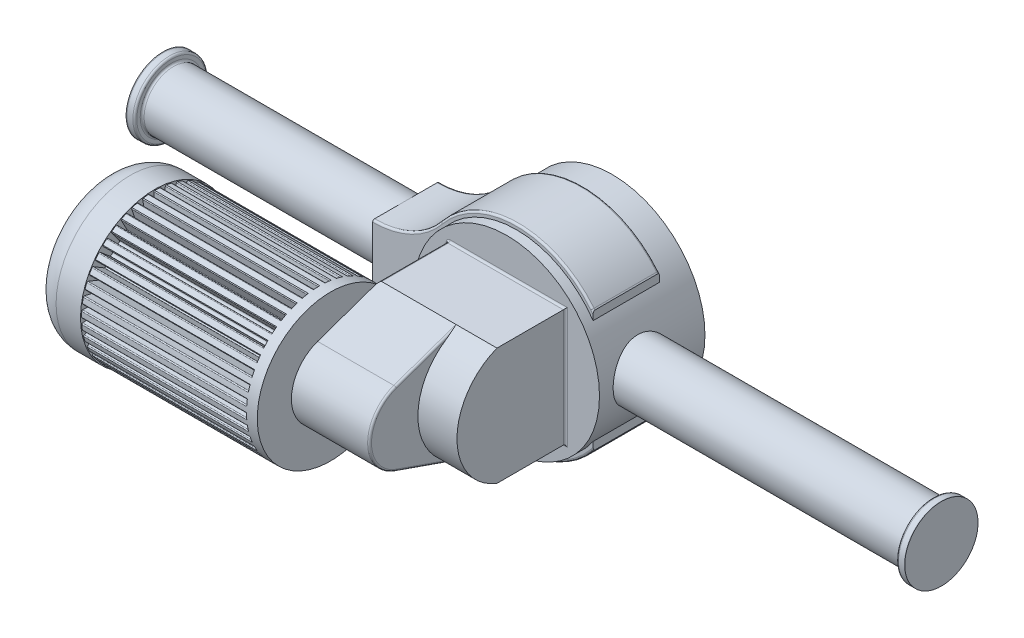
from build123d import *

# Parameters (mm, degrees)
SKETCH2_W                = 80
SKETCH2_H                = 80
BOSS_EXTRUDE1_DEPTH      = 10
BOSS_EXTRUDE2_DEPTH      = 34
BOSS_EXTRUDE2_DEPTH_BACK = 34
BOSS_EXTRUDE3_DEPTH      = 44
BOSS_EXTRUDE3_DEPTH_BACK = 64
SKETCH6_R                = 95
SKETCH8_W                = 120
SKETCH8_H                = 120
BOSS_EXTRUDE4_DEPTH      = 70
BOSS_EXTRUDE5_DEPTH      = 120
BOSS_EXTRUDE6_DEPTH      = 80
SKETCH12_R               = 75
BOSS_EXTRUDE7_DEPTH      = 180
CUT_EXTRUDE1_DEPTH       = 169
SKETCH15_R               = 76
BOSS_EXTRUDE8_DEPTH      = 50
FILLET2_R                = 25
FILLET5_R                = 2
FILLET11_R               = 2
FILLET10_R               = 2
FILLET12_R               = 2
CUT_EXTRUDE2_DEPTH       = 50
CUT_EXTRUDE2_DEPTH_BACK  = 50
SKETCH17_W               = 17.615936757
SKETCH17_H               = 93.359283861
SKETCH17_W_2             = 13.840446904
SKETCH17_H_2             = 90.695011225


with BuildPart() as part:
    # Sketch1 → Revolve1 (revolve)
    with BuildSketch(Plane.XY, mode=Mode.PRIVATE) as revolve1_sk:
        Polygon((-400, 0), (-400, 37.5), (-390, 37.5), (-390, 30), (390, 30), (390, 37.5), (400, 37.5), (400, 0), align=None)
    revolve(revolve1_sk.sketch.rotate(Axis((-87.962917736, 0, 0), (1, 0, 0)), 90), axis=Axis((-87.962917736, 0, 0), (1, 0, 0)))

    # Sketch2 → Boss-Extrude1 (add)
    with BuildSketch(Plane.ZY.offset(400)):
        Rectangle(SKETCH2_W, SKETCH2_H)
    boss_extrude1 = extrude(amount=BOSS_EXTRUDE1_DEPTH)

    # Mirror1: Boss-Extrude1 across plane
    add(boss_extrude1.mirror(Plane(origin=(0, 0, 0), x_dir=(0, 0, 1), z_dir=(1, 0, 0))))

    # Sketch3 → Boss-Extrude2 (add, two sides: drawn at the far end of the back side and taken through both)
    with BuildSketch(Plane.XY.offset(-BOSS_EXTRUDE2_DEPTH_BACK)):
        with BuildLine():
            Line((-150, 30), (-150, -30))
            ThreePointArc((-150, -30), (-111.372221612, -38.711041729), (-80.221958545, -63.157894737))
            ThreePointArc((-80.221958545, -63.157894737), (-2.690801373, -100), (74.840355798, -63.157894737))
            ThreePointArc((74.840355798, -63.157894737), (75.302761599, -62.594924842), (75.769709321, -62.035716428))
            Line((75.769709321, -62.035716428), (75.769709321, 62.035716428))
            ThreePointArc((75.769709321, 62.035716428), (75.302761599, 62.594924842), (74.840355798, 63.157894737))
            ThreePointArc((74.840355798, 63.157894737), (-2.690801373, 100), (-80.221958545, 63.157894737))
            ThreePointArc((-80.221958545, 63.157894737), (-111.372221612, 38.711041729), (-150, 30))
        make_face()
    extrude(amount=BOSS_EXTRUDE2_DEPTH + BOSS_EXTRUDE2_DEPTH_BACK)

    # Sketch6 → Boss-Extrude3 (add, two sides: drawn at the far end of the back side and taken through both)
    with BuildSketch(Plane.XY.offset(-BOSS_EXTRUDE3_DEPTH_BACK)):
        with Locations((-2.690801373, 0)):
            Circle(SKETCH6_R)
    extrude(amount=BOSS_EXTRUDE3_DEPTH + BOSS_EXTRUDE3_DEPTH_BACK)

    # Sketch8 → Boss-Extrude4 (add)
    with BuildSketch(Plane.XY.offset(44)):
        with Locations((-2.690801373, 0)):
            Rectangle(SKETCH8_W, SKETCH8_H)
    extrude(amount=BOSS_EXTRUDE4_DEPTH)

    # Sketch9 → Boss-Extrude5 (add)
    with BuildSketch(Plane.ZY.offset(62.690801373)):
        with BuildLine():
            Line((114, 60), (114, -60))
            ThreePointArc((114, -60), (154.958217767, 0), (114, 60))
        make_face()
    extrude(amount=-BOSS_EXTRUDE5_DEPTH)

    # Sketch10 → Boss-Extrude6 (add)
    with BuildSketch(Plane.ZY.offset(62.690801373)):
        with BuildLine():
            Line((114, 60), (177.646121856, 37.761245673))
            ThreePointArc((177.646121856, 37.761245673), (204.451868363, 0), (177.646121856, -37.761245673))
            Line((177.646121856, -37.761245673), (114, -60))
            Line((114, -60), (114, 60))
        make_face()
    extrude(amount=-BOSS_EXTRUDE6_DEPTH)

    # Sketch12 → Boss-Extrude7 (add)
    with BuildSketch(Plane.ZY.offset(62.690801373)):
        with Locations(Location((164.451868363, 0, 0), (0, 0, 231.491008622))):
            Circle(SKETCH12_R)
    extrude(amount=BOSS_EXTRUDE7_DEPTH)

    # Sketch16 → Cut-Extrude1 (cut)
    with BuildSketch(Plane.ZY.offset(242.690801373)):
        with BuildLine():
            Line((165.168620405, 74.031258154), (165.048525363, 61.626986417))
            ThreePointArc((165.048525363, 61.626986417), (166.745197324, 59.476693186), (168.856552476, 61.221581761))
            Line((168.856552476, 61.221581761), (169.967573087, 73.800909068))
            ThreePointArc((169.967573087, 73.800909068), (170.321548193, 74.47951171), (171.051693109, 74.70905108))
            Line((171.051693109, 74.70905108), (171.051693109, 75.290390487))
            Line((171.051693109, 75.290390487), (169.611616967, 75.290390487))
            Line((169.611616967, 75.290390487), (164.451868363, 75.611131893))
            Line((164.451868363, 75.611131893), (164.451868363, 75))
            ThreePointArc((164.451868363, 75), (164.972555561, 74.635719757), (165.168620405, 74.031258154))
        make_face()
        with BuildLine():
            Line((176.740836264, 73.007685796), (174.681764177, 60.774918231))
            ThreePointArc((174.681764177, 60.774918231), (176.02116732, 58.385680707), (178.379488898, 59.778798095))
            Line((178.379488898, 59.778798095), (181.444671338, 72.029451094))
            ThreePointArc((181.444671338, 72.029451094), (181.900445265, 72.644325105), (182.657508754, 72.756818636))
            Line((182.657508754, 72.756818636), (182.748450273, 73.331000789))
            Line((182.748450273, 73.331000789), (181.326103858, 73.55627833))
            Line((181.326103858, 73.55627833), (176.280055332, 74.68023339))
            Line((176.280055332, 74.68023339), (176.184453241, 74.076625545))
            ThreePointArc((176.184453241, 74.076625545), (176.641743931, 73.635376773), (176.740836264, 73.007685796))
        make_face()
        with BuildLine():
            Line((188.010456948, 70.186421915), (184.063109006, 58.426369858))
            ThreePointArc((184.063109006, 58.426369858), (185.012262779, 55.857018999), (187.559481078, 56.864062026))
            Line((187.559481078, 56.864062026), (192.503350385, 68.484388982))
            ThreePointArc((192.503350385, 68.484388982), (193.049700465, 69.020394123), (193.815041111, 69.01307185))
            Line((193.815041111, 69.01307185), (193.994684867, 69.565958481))
            Line((193.994684867, 69.565958481), (192.625091069, 70.010966482))
            Line((192.625091069, 70.010966482), (187.816993082, 71.910459691))
            Line((187.816993082, 71.910459691), (187.628142941, 71.329238722))
            ThreePointArc((187.628142941, 71.329238722), (188.010777108, 70.821886431), (188.010456948, 70.186421915))
        make_face()
        with BuildLine():
            Line((198.699986995, 65.636935391), (192.961560003, 54.639170354))
            ThreePointArc((192.961560003, 54.639170354), (193.497093091, 51.952972105), (196.170487144, 52.549144029))
            Line((196.170487144, 52.549144029), (202.871308846, 63.253013927))
            ThreePointArc((202.871308846, 63.253013927), (203.494782128, 63.696951973), (204.249554705, 63.569994194))
            Line((204.249554705, 63.569994194), (204.513477273, 64.087971398))
            Line((204.513477273, 64.087971398), (203.230360035, 64.741752286))
            Line((203.230360035, 64.741752286), (198.778603917, 67.370011818))
            Line((198.778603917, 67.370011818), (198.501155843, 66.825489314))
            ThreePointArc((198.501155843, 66.825489314), (198.799711765, 66.2645262), (198.699986995, 65.636935391))
        make_face()
        with BuildLine():
            Line((208.546214698, 59.471249681), (201.158007775, 49.506573138))
            ThreePointArc((201.158007775, 49.506573138), (201.266733576, 46.769670615), (204.000475547, 46.940291704))
            Line((204.000475547, 46.940291704), (212.293253176, 56.464139744))
            ThreePointArc((212.293253176, 56.464139744), (212.978497678, 56.805079466), (213.70411718, 56.561612304))
            Line((213.70411718, 56.561612304), (214.04581991, 57.031925764))
            Line((214.04581991, 57.031925764), (212.880773838, 57.878381282))
            Line((212.880773838, 57.878381282), (208.894976599, 61.170690666))
            Line((208.894976599, 61.170690666), (208.535762285, 60.676274578))
            ThreePointArc((208.535762285, 60.676274578), (208.742888523, 60.075513415), (208.546214698, 59.471249681))
        make_face()
        with BuildLine():
            Line((217.306693253, 51.841184431), (208.450628573, 43.154959789))
            ThreePointArc((208.450628573, 43.154959789), (208.129869897, 40.434744614), (210.856645987, 40.175613613))
            Line((210.856645987, 40.175613613), (220.537183836, 48.284931047))
            ThreePointArc((220.537183836, 48.284931047), (221.267326563, 48.514477379), (221.94592583, 48.160495803))
            Line((221.94592583, 48.160495803), (222.356994867, 48.571564839))
            Line((222.356994867, 48.571564839), (221.338707261, 49.589852445))
            Line((221.338707261, 49.589852445), (217.917012458, 53.465144095))
            Line((217.917012458, 53.465144095), (217.484876952, 53.033008589))
            ThreePointArc((217.484876952, 53.033008589), (217.595473371, 52.40724211), (217.306693253, 51.841184431))
        make_face()
        with BuildLine():
            Line((224.765710604, 42.934617168), (214.659853871, 35.740728106))
            ThreePointArc((214.659853871, 35.740728106), (213.917508861, 33.104181007), (216.570176793, 32.421678579))
            Line((216.570176793, 32.421678579), (227.400107892, 38.916787099))
            ThreePointArc((227.400107892, 38.916787099), (228.157170309, 39.029287847), (228.772039974, 38.573508059))
            Line((228.772039974, 38.573508059), (229.242353433, 38.915210788))
            Line((229.242353433, 38.915210788), (228.395897915, 40.080256861))
            Line((228.395897915, 40.080256861), (225.622559029, 44.443108236))
            Line((225.622559029, 44.443108236), (225.128142941, 44.083893922))
            ThreePointArc((225.128142941, 44.083893922), (225.13948629, 43.448530576), (224.765710604, 42.934617168))
        make_face()
        with BuildLine():
            Line((230.73960099, 32.970857139), (219.632791936, 27.446441081))
            ThreePointArc((219.632791936, 27.446441081), (218.48713959, 24.958482596), (221.000381875, 23.869414217))
            Line((221.000381875, 23.869414217), (232.713037378, 28.590382695))
            ThreePointArc((232.713037378, 28.590382695), (233.478378094, 28.583067718), (234.014378026, 28.036712528))
            Line((234.014378026, 28.036712528), (234.53235523, 28.300635096))
            Line((234.53235523, 28.300635096), (233.878574343, 29.583752334))
            Line((233.878574343, 29.583752334), (231.821880181, 34.326735554))
            Line((231.821880181, 34.326735554), (231.277357677, 34.04928748))
            ThreePointArc((231.277357677, 34.04928748), (231.189168646, 33.41997202), (230.73960099, 32.970857139))
        make_face()
        with BuildLine():
            Line((235.081267401, 22.195245184), (223.246992527, 18.476331587))
            ThreePointArc((223.246992527, 18.476331587), (221.726242607, 16.198223511), (224.038174881, 14.729405658))
            Line((224.038174881, 14.729405658), (236.345150336, 17.559988183))
            ThreePointArc((236.345150336, 17.559988183), (237.099924124, 17.433037601), (237.543856226, 16.809560087))
            Line((237.543856226, 16.809560087), (238.096742856, 16.989203843))
            Line((238.096742856, 16.989203843), (237.651734855, 18.358797642))
            Line((237.651734855, 18.358797642), (236.362328054, 23.365124719))
            Line((236.362328054, 23.365124719), (235.781107085, 23.176274578))
            ThreePointArc((235.781107085, 23.176274578), (235.59555718, 22.56850284), (235.081267401, 22.195245184))
        make_face()
        with BuildLine():
            Line((237.683803603, 10.87311263), (225.413462031, 9.05127349))
            ThreePointArc((225.413462031, 9.05127349), (223.555060449, 7.039110405), (225.608755264, 5.226710249))
            Line((225.608755264, 5.226710249), (238.207012093, 6.097208484))
            ThreePointArc((238.207012093, 6.097208484), (238.932633916, 5.85374824), (239.273567105, 5.168500488))
            Line((239.273567105, 5.168500488), (239.847749259, 5.259442007))
            Line((239.847749259, 5.259442007), (239.622471718, 6.681788422))
            Line((239.622471718, 6.681788422), (239.132101753, 11.828186969))
            Line((239.132101753, 11.828186969), (238.528493908, 11.732584878))
            ThreePointArc((238.528493908, 11.732584878), (238.250151983, 11.161322218), (237.683803603, 10.87311263))
        make_face()
        with BuildLine():
            Line((238.483126517, -0.716752042), (226.07885478, -0.596657))
            ThreePointArc((226.07885478, -0.596657), (223.928561549, -2.293328961), (225.673450124, -4.404684113))
            Line((225.673450124, -4.404684113), (238.252777431, -5.515704724))
            ThreePointArc((238.252777431, -5.515704724), (238.931380073, -5.86967983), (239.160919443, -6.599824746))
            Line((239.160919443, -6.599824746), (239.74225885, -6.599824746))
            Line((239.74225885, -6.599824746), (239.74225885, -5.159748604))
            Line((239.74225885, -5.159748604), (240.063000256, 0))
            Line((240.063000256, 0), (239.451868363, 0))
            ThreePointArc((239.451868363, 0), (239.08758812, -0.520687198), (238.483126517, -0.716752042))
        make_face()
        with BuildLine():
            Line((237.459554159, -12.288967901), (225.226786594, -10.229895814))
            ThreePointArc((225.226786594, -10.229895814), (222.837549071, -11.569298957), (224.230666458, -13.927620535))
            Line((224.230666458, -13.927620535), (236.481319457, -16.992802975))
            ThreePointArc((236.481319457, -16.992802975), (237.096193468, -17.448576902), (237.208686999, -18.205640391))
            Line((237.208686999, -18.205640391), (237.782869152, -18.29658191))
            Line((237.782869152, -18.29658191), (238.008146693, -16.874235495))
            Line((238.008146693, -16.874235495), (239.132101753, -11.828186969))
            Line((239.132101753, -11.828186969), (238.528493908, -11.732584878))
            ThreePointArc((238.528493908, -11.732584878), (238.087245136, -12.189875568), (237.459554159, -12.288967901))
        make_face()
        with BuildLine():
            Line((234.638290278, -23.558588585), (222.878238221, -19.611240643))
            ThreePointArc((222.878238221, -19.611240643), (220.308887362, -20.560394416), (221.315930389, -23.107612715))
            Line((221.315930389, -23.107612715), (232.936257345, -28.051482022))
            ThreePointArc((232.936257345, -28.051482022), (233.472262486, -28.597832102), (233.464940213, -29.363172748))
            Line((233.464940213, -29.363172748), (234.017826844, -29.542816504))
            Line((234.017826844, -29.542816504), (234.462834845, -28.173222706))
            Line((234.462834845, -28.173222706), (236.362328055, -23.365124719))
            Line((236.362328055, -23.365124719), (235.781107085, -23.176274578))
            ThreePointArc((235.781107085, -23.176274578), (235.273754794, -23.558908745), (234.638290278, -23.558588585))
        make_face()
        with BuildLine():
            Line((230.088803754, -34.248118632), (219.091038717, -28.50969164))
            ThreePointArc((219.091038717, -28.50969164), (216.404840468, -29.045224728), (217.001012392, -31.718618781))
            Line((217.001012392, -31.718618781), (227.70488229, -38.419440483))
            ThreePointArc((227.70488229, -38.419440483), (228.148820336, -39.042913765), (228.021862557, -39.797686342))
            Line((228.021862557, -39.797686342), (228.539839761, -40.06160891))
            Line((228.539839761, -40.06160891), (229.193620649, -38.778491672))
            Line((229.193620649, -38.778491672), (231.821880181, -34.326735554))
            Line((231.821880181, -34.326735554), (231.277357677, -34.04928748))
            ThreePointArc((231.277357677, -34.04928748), (230.716394563, -34.347843402), (230.088803754, -34.248118632))
        make_face()
        with BuildLine():
            Line((223.923118044, -44.094346334), (213.958441501, -36.706139412))
            ThreePointArc((213.958441501, -36.706139412), (211.221538978, -36.814865213), (211.392160067, -39.548607184))
            Line((211.392160067, -39.548607184), (220.916008107, -47.841384813))
            ThreePointArc((220.916008107, -47.841384813), (221.256947829, -48.526629315), (221.013480667, -49.252248817))
            Line((221.013480667, -49.252248817), (221.483794127, -49.593951547))
            Line((221.483794127, -49.593951547), (222.330249645, -48.428905475))
            Line((222.330249645, -48.428905475), (225.622559029, -44.443108236))
            Line((225.622559029, -44.443108236), (225.128142941, -44.083893922))
            ThreePointArc((225.128142941, -44.083893922), (224.527381778, -44.29102016), (223.923118044, -44.094346334))
        make_face()
        with BuildLine():
            Line((216.293052794, -52.85482489), (207.606828152, -43.99876021))
            ThreePointArc((207.606828152, -43.99876021), (204.886612978, -43.678001534), (204.627481976, -46.404777624))
            Line((204.627481976, -46.404777624), (212.73679941, -56.085315473))
            ThreePointArc((212.73679941, -56.085315473), (212.966345742, -56.8154582), (212.612364166, -57.494057467))
            Line((212.612364166, -57.494057467), (213.023433202, -57.905126504))
            Line((213.023433202, -57.905126504), (214.041720808, -56.886838898))
            Line((214.041720808, -56.886838898), (217.917012458, -53.465144095))
            Line((217.917012458, -53.465144095), (217.484876952, -53.033008589))
            ThreePointArc((217.484876952, -53.033008589), (216.859110473, -53.143605008), (216.293052794, -52.85482489))
        make_face()
        with BuildLine():
            Line((207.386485531, -60.313842241), (200.192596469, -50.207985508))
            ThreePointArc((200.192596469, -50.207985508), (197.55604937, -49.465640498), (196.873546942, -52.11830843))
            Line((196.873546942, -52.11830843), (203.368655462, -62.948239529))
            ThreePointArc((203.368655462, -62.948239529), (203.48115621, -63.705301946), (203.025376422, -64.320171611))
            Line((203.025376422, -64.320171611), (203.367079151, -64.79048507))
            Line((203.367079151, -64.79048507), (204.532125224, -63.944029552))
            Line((204.532125224, -63.944029552), (208.894976599, -61.170690666))
            Line((208.894976599, -61.170690666), (208.535762285, -60.676274578))
            ThreePointArc((208.535762285, -60.676274578), (207.900398939, -60.687617927), (207.386485531, -60.313842241))
        make_face()
        with BuildLine():
            Line((197.422725502, -66.287732627), (191.898309444, -55.180923573))
            ThreePointArc((191.898309444, -55.180923573), (189.410350959, -54.035271227), (188.32128258, -56.548513512))
            Line((188.32128258, -56.548513512), (193.042251058, -68.261169015))
            ThreePointArc((193.042251058, -68.261169015), (193.034936081, -69.026509731), (192.488580891, -69.562509663))
            Line((192.488580891, -69.562509663), (192.752503459, -70.080486867))
            Line((192.752503459, -70.080486867), (194.035620697, -69.42670598))
            Line((194.035620697, -69.42670598), (198.778603917, -67.370011818))
            Line((198.778603917, -67.370011818), (198.501155844, -66.825489314))
            ThreePointArc((198.501155844, -66.825489314), (197.871840383, -66.737300283), (197.422725502, -66.287732627))
        make_face()
        with BuildLine():
            Line((186.647113547, -70.629399038), (182.92819995, -58.795124164))
            ThreePointArc((182.92819995, -58.795124164), (180.650091874, -57.274374244), (179.181274021, -59.586306518))
            Line((179.181274021, -59.586306518), (182.011856546, -71.893281973))
            ThreePointArc((182.011856546, -71.893281973), (181.884905964, -72.648055761), (181.26142845, -73.091987863))
            Line((181.26142845, -73.091987863), (181.441072206, -73.644874493))
            Line((181.441072206, -73.644874493), (182.810666005, -73.199866492))
            Line((182.810666005, -73.199866492), (187.816993082, -71.910459691))
            Line((187.816993082, -71.910459691), (187.628142941, -71.329238722))
            ThreePointArc((187.628142941, -71.329238722), (187.020371203, -71.143688817), (186.647113547, -70.629399038))
        make_face()
        with BuildLine():
            Line((175.324980993, -73.23193524), (173.503141853, -60.961593668))
            ThreePointArc((173.503141853, -60.961593668), (171.490978768, -59.103192086), (169.678578612, -61.156886901))
            Line((169.678578612, -61.156886901), (170.549076847, -73.75514373))
            ThreePointArc((170.549076847, -73.75514373), (170.305616603, -74.480765553), (169.620368851, -74.821698742))
            Line((169.620368851, -74.821698742), (169.71131037, -75.395880896))
            Line((169.71131037, -75.395880896), (171.133656785, -75.170603355))
            Line((171.133656785, -75.170603355), (176.280055332, -74.68023339))
            Line((176.280055332, -74.68023339), (176.184453241, -74.076625545))
            ThreePointArc((176.184453241, -74.076625545), (175.613190581, -73.79828362), (175.324980993, -73.23193524))
        make_face()
        with BuildLine():
            Line((163.735116321, -74.031258154), (163.855211363, -61.626986417))
            ThreePointArc((163.855211363, -61.626986417), (162.158539402, -59.476693186), (160.04718425, -61.221581761))
            Line((160.04718425, -61.221581761), (158.936163639, -73.800909068))
            ThreePointArc((158.936163639, -73.800909068), (158.582188533, -74.47951171), (157.852043617, -74.70905108))
            Line((157.852043617, -74.70905108), (157.852043617, -75.290390487))
            Line((157.852043617, -75.290390487), (159.292119759, -75.290390487))
            Line((159.292119759, -75.290390487), (164.451868363, -75.611131893))
            Line((164.451868363, -75.611131893), (164.451868363, -75))
            ThreePointArc((164.451868363, -75), (163.931181165, -74.635719757), (163.735116321, -74.031258154))
        make_face()
        with BuildLine():
            Line((152.162900462, -73.007685796), (154.221972549, -60.774918231))
            ThreePointArc((154.221972549, -60.774918231), (152.882569406, -58.385680707), (150.524247828, -59.778798095))
            Line((150.524247828, -59.778798095), (147.459065388, -72.029451094))
            ThreePointArc((147.459065388, -72.029451094), (147.003291461, -72.644325105), (146.246227972, -72.756818636))
            Line((146.246227972, -72.756818636), (146.155286453, -73.331000789))
            Line((146.155286453, -73.331000789), (147.577632868, -73.55627833))
            Line((147.577632868, -73.55627833), (152.623681394, -74.68023339))
            Line((152.623681394, -74.68023339), (152.719283485, -74.076625545))
            ThreePointArc((152.719283485, -74.076625545), (152.261992795, -73.635376773), (152.162900462, -73.007685796))
        make_face()
        with BuildLine():
            Line((140.893279778, -70.186421915), (144.84062772, -58.426369858))
            ThreePointArc((144.84062772, -58.426369858), (143.891473947, -55.857018999), (141.344255648, -56.864062026))
            Line((141.344255648, -56.864062026), (136.400386341, -68.484388982))
            ThreePointArc((136.400386341, -68.484388982), (135.854036261, -69.020394123), (135.088695615, -69.01307185))
            Line((135.088695615, -69.01307185), (134.909051859, -69.565958481))
            Line((134.909051859, -69.565958481), (136.278645657, -70.010966482))
            Line((136.278645657, -70.010966482), (141.086743644, -71.910459691))
            Line((141.086743644, -71.910459691), (141.275593785, -71.329238722))
            ThreePointArc((141.275593785, -71.329238722), (140.892959618, -70.821886431), (140.893279778, -70.186421915))
        make_face()
        with BuildLine():
            Line((130.203749731, -65.636935391), (135.942176723, -54.639170354))
            ThreePointArc((135.942176723, -54.639170354), (135.406643635, -51.952972105), (132.733249582, -52.549144029))
            Line((132.733249582, -52.549144029), (126.03242788, -63.253013927))
            ThreePointArc((126.03242788, -63.253013927), (125.408954598, -63.696951973), (124.654182021, -63.569994194))
            Line((124.654182021, -63.569994194), (124.390259453, -64.087971398))
            Line((124.390259453, -64.087971398), (125.673376691, -64.741752286))
            Line((125.673376691, -64.741752286), (130.125132809, -67.370011818))
            Line((130.125132809, -67.370011818), (130.402580883, -66.825489314))
            ThreePointArc((130.402580883, -66.825489314), (130.104024961, -66.2645262), (130.203749731, -65.636935391))
        make_face()
        with BuildLine():
            Line((120.357522029, -59.471249681), (127.745728951, -49.506573138))
            ThreePointArc((127.745728951, -49.506573138), (127.63700315, -46.769670615), (124.903261179, -46.940291704))
            Line((124.903261179, -46.940291704), (116.61048355, -56.464139744))
            ThreePointArc((116.61048355, -56.464139744), (115.925239048, -56.805079466), (115.199619546, -56.561612304))
            Line((115.199619546, -56.561612304), (114.857916816, -57.031925764))
            Line((114.857916816, -57.031925764), (116.022962888, -57.878381282))
            Line((116.022962888, -57.878381282), (120.008760127, -61.170690666))
            Line((120.008760127, -61.170690666), (120.367974441, -60.676274578))
            ThreePointArc((120.367974441, -60.676274578), (120.160848203, -60.075513415), (120.357522029, -59.471249681))
        make_face()
        with BuildLine():
            Line((111.597043473, -51.841184431), (120.453108153, -43.154959789))
            ThreePointArc((120.453108153, -43.154959789), (120.773866829, -40.434744614), (118.047090739, -40.175613613))
            Line((118.047090739, -40.175613613), (108.36655289, -48.284931047))
            ThreePointArc((108.36655289, -48.284931047), (107.636410163, -48.514477379), (106.957810896, -48.160495803))
            Line((106.957810896, -48.160495803), (106.546741859, -48.571564839))
            Line((106.546741859, -48.571564839), (107.565029465, -49.589852445))
            Line((107.565029465, -49.589852445), (110.986724268, -53.465144095))
            Line((110.986724268, -53.465144095), (111.418859774, -53.033008589))
            ThreePointArc((111.418859774, -53.033008589), (111.308263355, -52.40724211), (111.597043473, -51.841184431))
        make_face()
        with BuildLine():
            Line((104.138026122, -42.934617168), (114.243882855, -35.740728106))
            ThreePointArc((114.243882855, -35.740728106), (114.986227865, -33.104181007), (112.333559933, -32.421678579))
            Line((112.333559933, -32.421678579), (101.503628834, -38.916787099))
            ThreePointArc((101.503628834, -38.916787099), (100.746566417, -39.029287847), (100.131696752, -38.573508059))
            Line((100.131696752, -38.573508059), (99.661383293, -38.915210788))
            Line((99.661383293, -38.915210788), (100.507838811, -40.080256861))
            Line((100.507838811, -40.080256861), (103.281177698, -44.443108236))
            Line((103.281177698, -44.443108236), (103.775593785, -44.083893922))
            ThreePointArc((103.775593785, -44.083893922), (103.764250436, -43.448530576), (104.138026122, -42.934617168))
        make_face()
        with BuildLine():
            Line((98.164135736, -32.970857139), (109.27094479, -27.446441081))
            ThreePointArc((109.27094479, -27.446441081), (110.416597137, -24.958482596), (107.903354851, -23.869414217))
            Line((107.903354851, -23.869414217), (96.190699348, -28.590382695))
            ThreePointArc((96.190699348, -28.590382695), (95.425358632, -28.583067718), (94.8893587, -28.036712528))
            Line((94.8893587, -28.036712528), (94.371381496, -28.300635096))
            Line((94.371381496, -28.300635096), (95.025162383, -29.583752334))
            Line((95.025162383, -29.583752334), (97.081856545, -34.326735554))
            Line((97.081856545, -34.326735554), (97.626379049, -34.04928748))
            ThreePointArc((97.626379049, -34.04928748), (97.71456808, -33.41997202), (98.164135736, -32.970857139))
        make_face()
        with BuildLine():
            Line((93.822469325, -22.195245184), (105.656744199, -18.476331587))
            ThreePointArc((105.656744199, -18.476331587), (107.177494119, -16.198223511), (104.865561845, -14.729405658))
            Line((104.865561845, -14.729405658), (92.55858639, -17.559988183))
            ThreePointArc((92.55858639, -17.559988183), (91.803812602, -17.433037601), (91.359880501, -16.809560087))
            Line((91.359880501, -16.809560087), (90.80699387, -16.989203843))
            Line((90.80699387, -16.989203843), (91.252001871, -18.358797642))
            Line((91.252001871, -18.358797642), (92.541408672, -23.365124719))
            Line((92.541408672, -23.365124719), (93.122629641, -23.176274578))
            ThreePointArc((93.122629641, -23.176274578), (93.308179546, -22.56850284), (93.822469325, -22.195245184))
        make_face()
        with BuildLine():
            Line((91.219933123, -10.87311263), (103.490274695, -9.05127349))
            ThreePointArc((103.490274695, -9.05127349), (105.348676277, -7.039110405), (103.294981462, -5.226710249))
            Line((103.294981462, -5.226710249), (90.696724633, -6.097208484))
            ThreePointArc((90.696724633, -6.097208484), (89.97110281, -5.85374824), (89.630169621, -5.168500488))
            Line((89.630169621, -5.168500488), (89.055987467, -5.259442007))
            Line((89.055987467, -5.259442007), (89.281265008, -6.681788422))
            Line((89.281265008, -6.681788422), (89.771634973, -11.828186969))
            Line((89.771634973, -11.828186969), (90.375242818, -11.732584878))
            ThreePointArc((90.375242818, -11.732584878), (90.653584743, -11.161322218), (91.219933123, -10.87311263))
        make_face()
        with BuildLine():
            Line((90.420610209, 0.716752042), (102.824881946, 0.596657))
            ThreePointArc((102.824881946, 0.596657), (104.975175177, 2.293328961), (103.230286602, 4.404684113))
            Line((103.230286602, 4.404684113), (90.650959295, 5.515704724))
            ThreePointArc((90.650959295, 5.515704724), (89.972356653, 5.86967983), (89.742817283, 6.599824746))
            Line((89.742817283, 6.599824746), (89.161477876, 6.599824746))
            Line((89.161477876, 6.599824746), (89.161477876, 5.159748604))
            Line((89.161477876, 5.159748604), (88.84073647, 0))
            Line((88.84073647, 0), (89.451868363, 0))
            ThreePointArc((89.451868363, 0), (89.816148606, 0.520687198), (90.420610209, 0.716752042))
        make_face()
        with BuildLine():
            Line((91.444182567, 12.288967901), (103.676950132, 10.229895814))
            ThreePointArc((103.676950132, 10.229895814), (106.066187656, 11.569298957), (104.673070268, 13.927620535))
            Line((104.673070268, 13.927620535), (92.422417269, 16.992802975))
            ThreePointArc((92.422417269, 16.992802975), (91.807543258, 17.448576902), (91.695049727, 18.205640391))
            Line((91.695049727, 18.205640391), (91.120867574, 18.29658191))
            Line((91.120867574, 18.29658191), (90.895590033, 16.874235495))
            Line((90.895590033, 16.874235495), (89.771634973, 11.828186969))
            Line((89.771634973, 11.828186969), (90.375242818, 11.732584878))
            ThreePointArc((90.375242818, 11.732584878), (90.81649159, 12.189875568), (91.444182567, 12.288967901))
        make_face()
        with BuildLine():
            Line((94.265446448, 23.558588585), (106.025498505, 19.611240643))
            ThreePointArc((106.025498505, 19.611240643), (108.594849364, 20.560394416), (107.587806337, 23.107612715))
            Line((107.587806337, 23.107612715), (95.967479381, 28.051482022))
            ThreePointArc((95.967479381, 28.051482022), (95.43147424, 28.597832102), (95.438796513, 29.363172748))
            Line((95.438796513, 29.363172748), (94.885909882, 29.542816504))
            Line((94.885909882, 29.542816504), (94.440901881, 28.173222706))
            Line((94.440901881, 28.173222706), (92.541408672, 23.365124719))
            Line((92.541408672, 23.365124719), (93.122629641, 23.176274578))
            ThreePointArc((93.122629641, 23.176274578), (93.629981932, 23.558908745), (94.265446448, 23.558588585))
        make_face()
        with BuildLine():
            Line((98.814932972, 34.248118632), (109.812698009, 28.50969164))
            ThreePointArc((109.812698009, 28.50969164), (112.498896258, 29.045224728), (111.902724334, 31.718618781))
            Line((111.902724334, 31.718618781), (101.198854436, 38.419440483))
            ThreePointArc((101.198854436, 38.419440483), (100.75491639, 39.042913765), (100.881874169, 39.797686342))
            Line((100.881874169, 39.797686342), (100.363896965, 40.06160891))
            Line((100.363896965, 40.06160891), (99.710116077, 38.778491672))
            Line((99.710116077, 38.778491672), (97.081856545, 34.326735554))
            Line((97.081856545, 34.326735554), (97.626379049, 34.04928748))
            ThreePointArc((97.626379049, 34.04928748), (98.187342163, 34.347843402), (98.814932972, 34.248118632))
        make_face()
        with BuildLine():
            Line((104.980618682, 44.094346334), (114.945295225, 36.706139412))
            ThreePointArc((114.945295225, 36.706139412), (117.682197748, 36.814865213), (117.511576659, 39.548607184))
            Line((117.511576659, 39.548607184), (107.987728619, 47.841384813))
            ThreePointArc((107.987728619, 47.841384813), (107.646788897, 48.526629315), (107.890256059, 49.252248817))
            Line((107.890256059, 49.252248817), (107.419942599, 49.593951547))
            Line((107.419942599, 49.593951547), (106.573487081, 48.428905475))
            Line((106.573487081, 48.428905475), (103.281177697, 44.443108236))
            Line((103.281177697, 44.443108236), (103.775593785, 44.083893922))
            ThreePointArc((103.775593785, 44.083893922), (104.376354948, 44.29102016), (104.980618682, 44.094346334))
        make_face()
        with BuildLine():
            Line((112.610683932, 52.85482489), (121.296908574, 43.99876021))
            ThreePointArc((121.296908574, 43.99876021), (124.017123749, 43.678001534), (124.27625475, 46.404777624))
            Line((124.27625475, 46.404777624), (116.166937316, 56.085315473))
            ThreePointArc((116.166937316, 56.085315473), (115.937390984, 56.8154582), (116.29137256, 57.494057467))
            Line((116.29137256, 57.494057467), (115.880303524, 57.905126504))
            Line((115.880303524, 57.905126504), (114.862015918, 56.886838898))
            Line((114.862015918, 56.886838898), (110.986724268, 53.465144095))
            Line((110.986724268, 53.465144095), (111.418859774, 53.033008589))
            ThreePointArc((111.418859774, 53.033008589), (112.044626253, 53.143605008), (112.610683932, 52.85482489))
        make_face()
        with BuildLine():
            Line((121.517251195, 60.313842241), (128.711140257, 50.207985508))
            ThreePointArc((128.711140257, 50.207985508), (131.347687356, 49.465640498), (132.030189784, 52.11830843))
            Line((132.030189784, 52.11830843), (125.535081264, 62.948239529))
            ThreePointArc((125.535081264, 62.948239529), (125.422580516, 63.705301946), (125.878360304, 64.320171611))
            Line((125.878360304, 64.320171611), (125.536657575, 64.79048507))
            Line((125.536657575, 64.79048507), (124.371611502, 63.944029552))
            Line((124.371611502, 63.944029552), (120.008760127, 61.170690666))
            Line((120.008760127, 61.170690666), (120.367974441, 60.676274578))
            ThreePointArc((120.367974441, 60.676274578), (121.003337788, 60.687617927), (121.517251195, 60.313842241))
        make_face()
        with BuildLine():
            Line((131.481011224, 66.287732627), (137.005427282, 55.180923573))
            ThreePointArc((137.005427282, 55.180923573), (139.493385767, 54.035271227), (140.582454146, 56.548513512))
            Line((140.582454146, 56.548513512), (135.861485668, 68.261169015))
            ThreePointArc((135.861485668, 68.261169015), (135.868800645, 69.026509731), (136.415155835, 69.562509663))
            Line((136.415155835, 69.562509663), (136.151233267, 70.080486867))
            Line((136.151233267, 70.080486867), (134.868116029, 69.42670598))
            Line((134.868116029, 69.42670598), (130.125132809, 67.370011818))
            Line((130.125132809, 67.370011818), (130.402580883, 66.825489314))
            ThreePointArc((130.402580883, 66.825489314), (131.031896343, 66.737300283), (131.481011224, 66.287732627))
        make_face()
        with BuildLine():
            Line((142.256623179, 70.629399038), (145.975536776, 58.795124164))
            ThreePointArc((145.975536776, 58.795124164), (148.253644852, 57.274374244), (149.722462705, 59.586306518))
            Line((149.722462705, 59.586306518), (146.89188018, 71.893281973))
            ThreePointArc((146.89188018, 71.893281973), (147.018830762, 72.648055761), (147.642308276, 73.091987863))
            Line((147.642308276, 73.091987863), (147.46266452, 73.644874493))
            Line((147.46266452, 73.644874493), (146.093070721, 73.199866492))
            Line((146.093070721, 73.199866492), (141.086743644, 71.910459691))
            Line((141.086743644, 71.910459691), (141.275593785, 71.329238722))
            ThreePointArc((141.275593785, 71.329238722), (141.883365523, 71.143688817), (142.256623179, 70.629399038))
        make_face()
        with BuildLine():
            Line((153.578755733, 73.23193524), (155.400594873, 60.961593668))
            ThreePointArc((155.400594873, 60.961593668), (157.412757958, 59.103192086), (159.225158114, 61.156886901))
            Line((159.225158114, 61.156886901), (158.354659879, 73.75514373))
            ThreePointArc((158.354659879, 73.75514373), (158.598120123, 74.480765553), (159.283367875, 74.821698742))
            Line((159.283367875, 74.821698742), (159.192426356, 75.395880896))
            Line((159.192426356, 75.395880896), (157.770079941, 75.170603355))
            Line((157.770079941, 75.170603355), (152.623681394, 74.68023339))
            Line((152.623681394, 74.68023339), (152.719283485, 74.076625545))
            ThreePointArc((152.719283485, 74.076625545), (153.290546145, 73.79828362), (153.578755733, 73.23193524))
        make_face()
    extrude(amount=-CUT_EXTRUDE1_DEPTH, mode=Mode.SUBTRACT)

    # Sketch15 → Boss-Extrude8 (add)
    with BuildSketch(Plane.ZY.offset(242.690801373)):
        with Locations((164.451868363, 0)):
            Circle(SKETCH15_R)
    extrude(amount=BOSS_EXTRUDE8_DEPTH)

    # Fillet2
    fillet2_edges = [part.edges().sort_by_distance(p)[0] for p in [
        (-292.690801373, 0, 88.451868363),
    ]]
    fillet(fillet2_edges, radius=FILLET2_R)

    # Fillet5
    fillet5_edges = [part.edges().sort_by_distance(p)[0] for p in [
        (400, 0, -37.5),
        (75.302761599, 62.594924842, 34),
        (75.302761599, -62.594924842, -34),
        (-2.690801373, -100, -34),
        (-111.372221612, -38.711041729, -34),
        (-111.372221612, 38.711041729, 34),
        (-2.690801373, 100, -34),
        (75.302761599, 62.594924842, -34),
        (-111.372221612, 38.711041729, -34),
        (-2.690801373, 100, 34),
        (-111.372221612, -38.711041729, 34),
        (-2.690801373, -100, 34),
        (75.302761599, -62.594924842, 34),
        (-400, 0, -37.5),
        (-390, 0, -37.5),
        (-390, 0, -30),
        (390, 0, -30),
        (390, 0, -37.5),
    ]]
    fillet(fillet5_edges, radius=FILLET5_R)

    # Fillet11
    # the kernel refuses this fillet: 2 mm, written as the material it takes off along each edge
    with BuildSketch(Plane(origin=(-62.690801373, 60, 44), x_dir=(1, 0, 0), z_dir=(0, 0, 1))) as fillet11_piece_1:
        with BuildLine():
            CenterArc((FILLET11_R, -FILLET11_R), FILLET11_R, 90, 90)
            Line((0, -FILLET11_R), (0, 0))
            Line((0, 0), (FILLET11_R, 0))
        make_face()
    extrude(amount=78.5, mode=Mode.SUBTRACT)

    # Fillet10
    fillet10_edges = [part.edges().sort_by_distance(p)[0] for p in [
        (-62.690801373, -1, 44),
        (-62.105014936, 59.414213562, 44),
        (57.309198627, 0, 44),
        (-1.690801373, 60, 44),
        (-2.690801373, -60, 44),
    ]]
    fillet(fillet10_edges, radius=FILLET10_R)

    # Fillet12
    # the kernel refuses this fillet: 2 mm, written as the material it takes off along each edge
    with BuildSketch(Plane(origin=(17.309198627, 68.246408433, 90.399221454), x_dir=(-1, 0, 0), z_dir=(0, -0.329856337322108, 0.9440311418213087))) as fillet12_piece_1_section:
        with BuildLine():
            CenterArc((FILLET12_R, FILLET12_R), FILLET12_R, 180, 90)
            Line((0, FILLET12_R), (0, 0))
            Line((0, 0), (FILLET12_R, 0))
        make_face()
    fillet12_piece_1 = extrude(amount=92.419515137, mode=Mode.PRIVATE)
    fillet12_piece_1 = fillet12_piece_1 - Plane(origin=(17.309198627, 0, 90.531884172), x_dir=(0, -0.9312962053215402, 0.3642627869460449), z_dir=(-1, 0, 0)) * Cylinder(64.426333595, 193, mode=Mode.PRIVATE)
    add(fillet12_piece_1, mode=Mode.SUBTRACT)
    with BuildSketch(Plane(origin=(17.309198627, 0, 164.451868363), x_dir=(0, 0.9440311418213085, 0.3298563373221084), z_dir=(0, 0.3298563373221084, -0.9440311418213085))) as fillet12_piece_2:
        with BuildLine():
            CenterArc((40 - FILLET12_R, -FILLET12_R), FILLET12_R, 0, 90)
            Line((40 - FILLET12_R, 0), (40, 0))
            Line((40, 0), (40, -FILLET12_R))
        make_face()
    revolve(axis=Axis((17.309198627, 0, 164.451868363), (1, 0, 0)), revolution_arc=141.479888026, mode=Mode.SUBTRACT)
    with BuildSketch(Plane(origin=(17.309198627, -37.761245673, 177.646121856), x_dir=(-1, 0, 0), z_dir=(0, -0.32985633732210784, -0.9440311418213088))) as fillet12_piece_3_section:
        with BuildLine():
            CenterArc((FILLET12_R, FILLET12_R), FILLET12_R, 180, 90)
            Line((0, FILLET12_R), (0, 0))
            Line((0, 0), (FILLET12_R, 0))
        make_face()
    fillet12_piece_3 = extrude(amount=92.419515137, mode=Mode.PRIVATE)
    fillet12_piece_3 = fillet12_piece_3 - Plane(origin=(17.309198627, 0, 90.531884172), x_dir=(0, -0.9312962053215402, 0.3642627869460449), z_dir=(-1, 0, 0)) * Cylinder(64.426333595, 193, mode=Mode.PRIVATE)
    add(fillet12_piece_3, mode=Mode.SUBTRACT)

    # Sketch17 → Cut-Extrude2 (cut, two sides: drawn at the far end of the back side and taken through both)
    with BuildSketch(Plane(origin=(0, 0, 0), x_dir=(1, 0, 0), z_dir=(0, 1, 0)).offset(-CUT_EXTRUDE2_DEPTH_BACK)):
        with Locations((-407.546180664, -0.591601198)):
            Rectangle(SKETCH17_W, SKETCH17_H)
        with Locations((405.336050318, -1.923737516)):
            Rectangle(SKETCH17_W_2, SKETCH17_H_2)
    extrude(amount=CUT_EXTRUDE2_DEPTH + CUT_EXTRUDE2_DEPTH_BACK, mode=Mode.SUBTRACT)


solid = part.part
